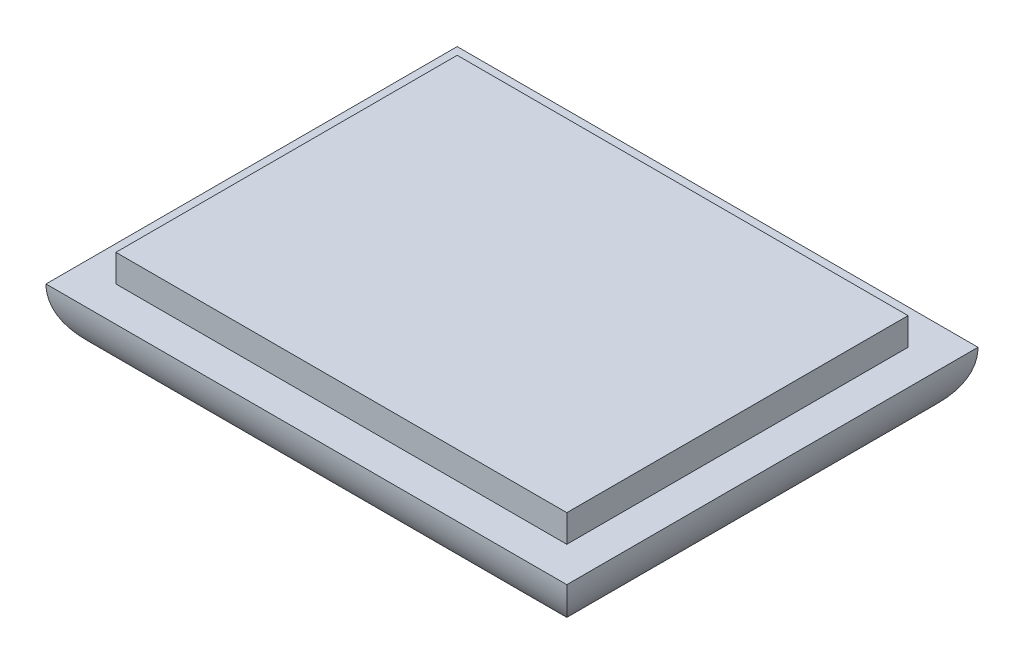
from build123d import *

# Parameters (mm, degrees)
SKETCH1_W           = 38
SKETCH1_H           = 30
BOSS_EXTRUDE1_DEPTH = 5
SKETCH2_W           = 32.9
SKETCH2_H           = 24.9
BOSS_EXTRUDE2_DEPTH = 2
FILLET1_R           = 5


with BuildPart() as part:
    # Sketch1 → Boss-Extrude1 (new body)
    with BuildSketch(Plane(origin=(0, 0, 0), x_dir=(1, 0, 0), z_dir=(0, 1, 0))):
        Rectangle(SKETCH1_W, SKETCH1_H)
    extrude(amount=BOSS_EXTRUDE1_DEPTH)

    # Fillet1
    fillet1_edges = [part.edges().sort_by_distance(p)[0] for p in [
        (-19, 0, 0),
        (0, 0, 15),
        (19, 0, 0),
        (0, 0, -15),
    ]]
    fillet(fillet1_edges, radius=FILLET1_R - 0.0001)  # a hair under: the kernel refuses the full size


with BuildPart() as body_2:
    # Sketch2 → Boss-Extrude2 (new body)
    with BuildSketch(Plane(origin=(0, 5, 0), x_dir=(1, 0, 0), z_dir=(0, 1, 0))):
        Rectangle(SKETCH2_W, SKETCH2_H)
    extrude(amount=BOSS_EXTRUDE2_DEPTH)


solid = Compound([part.part, body_2.part])
